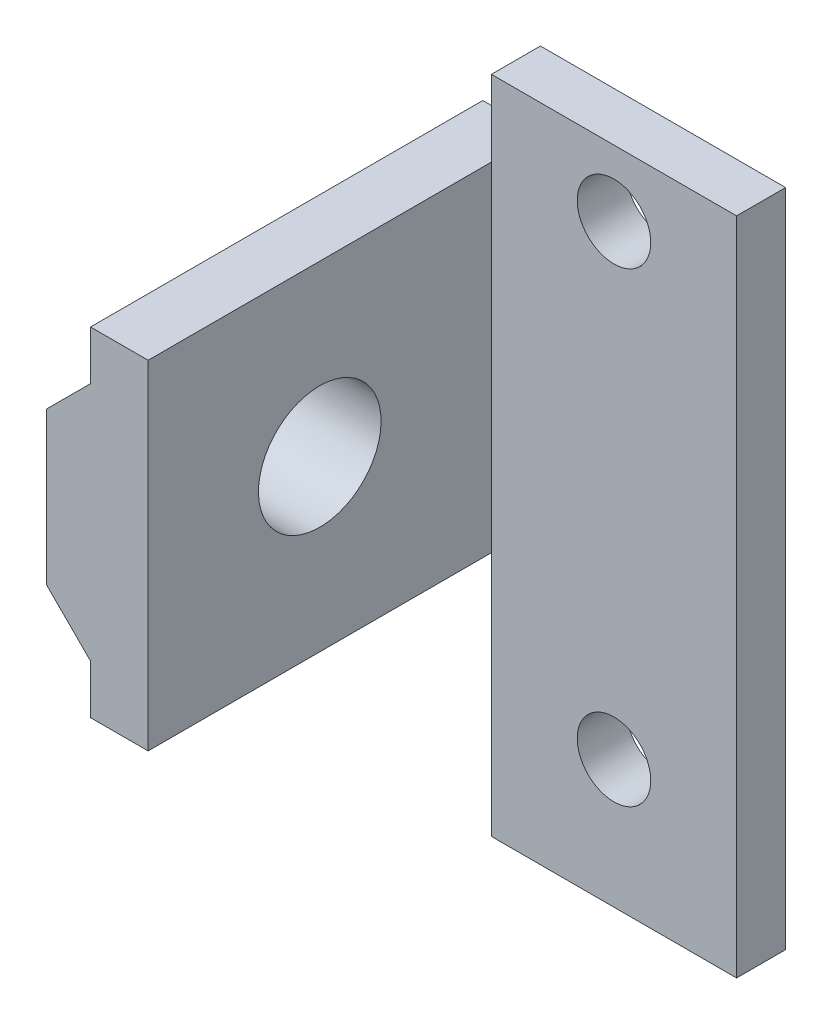
from build123d import *

# Parameters (mm, degrees)
SKETCH1_W           = 10
SKETCH1_H           = 26.92
SKETCH1_R           = 1.5
BOSS_EXTRUDE1_DEPTH = 2
BOSS_EXTRUDE2_DEPTH = 16
SKETCH5_R           = 2.5
CUT_EXTRUDE1_DEPTH  = 16


with BuildPart() as part:
    # Sketch1 → Boss-Extrude1 (new body)
    with BuildSketch(Plane.XY):
        with Locations((5, 13.46)):
            Rectangle(SKETCH1_W, SKETCH1_H)
        with Locations((5, 24.22)):
            Circle(SKETCH1_R, mode=Mode.SUBTRACT)
        with Locations((5, 5.22)):
            Circle(SKETCH1_R, mode=Mode.SUBTRACT)
    extrude(amount=BOSS_EXTRUDE1_DEPTH)

    # Sketch2 → Boss-Extrude2 (add)
    with BuildSketch(Plane(origin=(0, 0, 0), x_dir=(-1, 0, 0), z_dir=(0, 0, -1))):
        Polygon((2.35, 21.82), (4.15, 20.02), (4.15, 13.82), (2.35, 12.02), (2.35, 10.02), (0, 10.02), (0, 12.02), (0, 21.82), (0, 23.82), (2.35, 23.82), align=None)
    extrude(amount=-BOSS_EXTRUDE2_DEPTH)

    # Sketch5 → Cut-Extrude1 (cut)
    with BuildSketch(Plane(origin=(0, 0, 0), x_dir=(0, 0, -1), z_dir=(1, 0, 0))):
        with Locations((-9, 16.92)):
            Circle(SKETCH5_R)
    extrude(amount=-CUT_EXTRUDE1_DEPTH, mode=Mode.SUBTRACT)


solid = part.part
